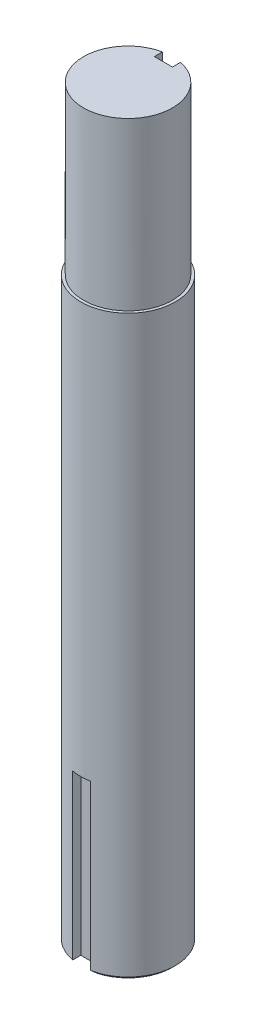
from build123d import *

# Parameters (mm, degrees)
SKETCH1_W          = 8.5
SKETCH1_H          = 134
SKETCH2_W          = 3.25
SKETCH2_H          = 3.25
CUT_EXTRUDE1_DEPTH = 30
CHAMFER1_SIZE      = 0.5
SKETCH4_OUTSIDE_W  = 46.228
SKETCH4_OUTSIDE_H  = 46.228
SKETCH4_OUTSIDE_R  = 8
CUT_EXTRUDE3_DEPTH = 30
SKETCH3_W          = 3.25
SKETCH3_H          = 3.25
CUT_EXTRUDE2_DEPTH = 25


with BuildPart() as part:
    # Sketch1 → Revolve1 (revolve)
    with BuildSketch(Plane.XY):
        with Locations((4.25, 67)):
            Rectangle(SKETCH1_W, SKETCH1_H)
    revolve(axis=Axis((0, 134, 0), (0, -1, 0)))

    # Sketch2 → Cut-Extrude1 (cut)
    with BuildSketch(Plane.XZ):
        with Locations((0, 8.5)):
            Rectangle(SKETCH2_W, SKETCH2_H)
    extrude(amount=-CUT_EXTRUDE1_DEPTH, mode=Mode.SUBTRACT)

    # Chamfer1
    chamfer1_edges = [part.edges().sort_by_distance(p)[0] for p in [
        (-8.5, 134, 0),
        (-1.625, 0, 7.609111649),
        (0, 0, 6.875),
        (1.625, 0, 7.609111649),
        (-5.405437078, 0, -6.559820882),
    ]]
    chamfer(chamfer1_edges, length=CHAMFER1_SIZE)

    # Sketch4 outside → Cut-Extrude3 (cut)
    with BuildSketch(Plane(origin=(0, 134, 0), x_dir=(1, 0, 0), z_dir=(0, 1, 0))):
        Rectangle(SKETCH4_OUTSIDE_W, SKETCH4_OUTSIDE_H)
        Circle(SKETCH4_OUTSIDE_R, mode=Mode.SUBTRACT)
    extrude(amount=-CUT_EXTRUDE3_DEPTH, mode=Mode.SUBTRACT)

    # Sketch3 → Cut-Extrude2 (cut)
    with BuildSketch(Plane(origin=(0, 134, 0), x_dir=(1, 0, 0), z_dir=(0, 1, 0))):
        with Locations((0, 8)):
            Rectangle(SKETCH3_W, SKETCH3_H)
    extrude(amount=-CUT_EXTRUDE2_DEPTH, mode=Mode.SUBTRACT)


solid = part.part
